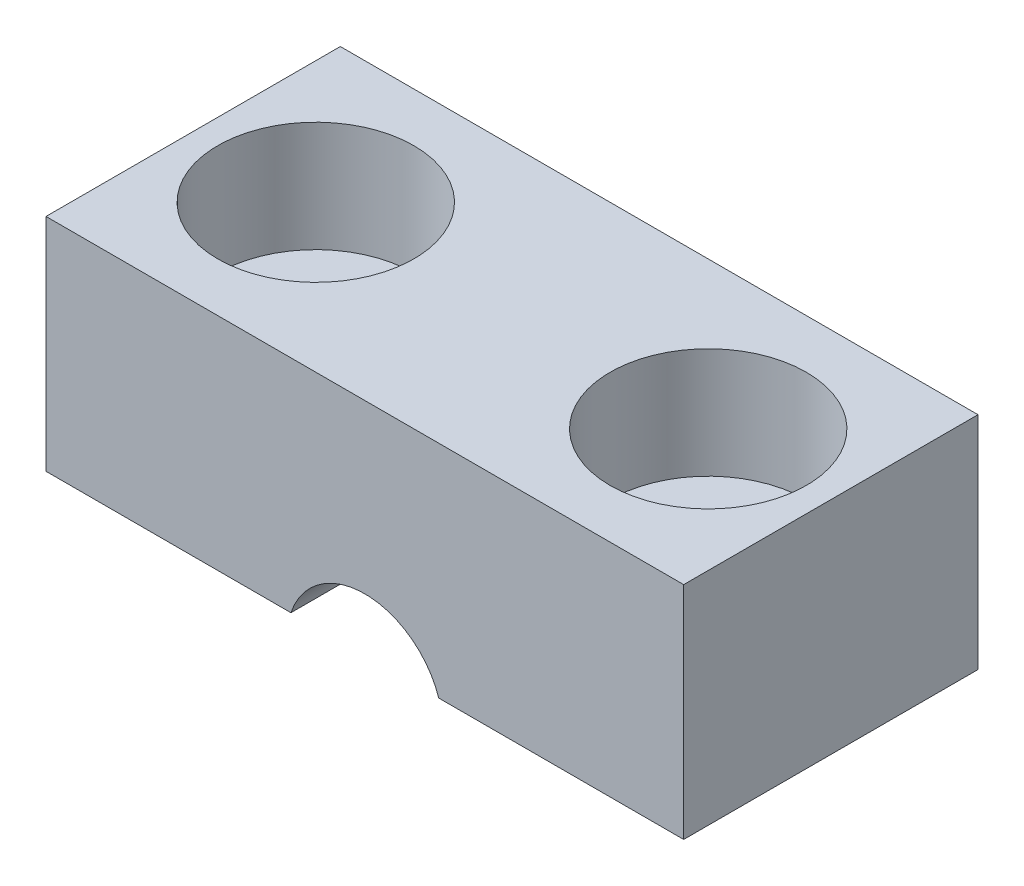
from build123d import *

# Parameters (mm, degrees)
SKETCH1_W                                        = 26
SKETCH1_H                                        = 12
BOSS_EXTRUDE1_DEPTH                              = 9
CUT_EXTRUDE1_DEPTH                               = 40.217343102
CBORE_FOR_M4_HEX_HEAD_MACHINE_SCREW1_D           = 4.5
CBORE_FOR_M4_HEX_HEAD_MACHINE_SCREW1_CBORE_D     = 8
CBORE_FOR_M4_HEX_HEAD_MACHINE_SCREW1_CBORE_DEPTH = 4.5


with BuildPart() as part:
    # Sketch1 → Boss-Extrude1 (new body)
    with BuildSketch(Plane(origin=(0, 35, 0), x_dir=(1, 0, 0), z_dir=(0, 1, 0))):
        Rectangle(SKETCH1_W, SKETCH1_H)
    extrude(amount=-BOSS_EXTRUDE1_DEPTH)

    # Sketch2 → Cut-Extrude1 (cut, through all)
    with BuildSketch(Plane(origin=(0, 0, -6), x_dir=(-1, 0, 0), z_dir=(0, 0, -1))):
        with BuildLine():
            Line((-3.01340754, 26), (3.01340754, 26))
            ThreePointArc((3.01340754, 26), (0, 28.175), (-3.01340754, 26))
        make_face()
    extrude(amount=-CUT_EXTRUDE1_DEPTH, mode=Mode.SUBTRACT)

    # CBORE for M4 Hex Head Machine Screw1 (through all)
    with Locations(Plane(origin=(0, 35, 0), x_dir=(1, 0, 0), z_dir=(0, 1, 0))):
        with Locations((-8, 0), (8, 0)):
            CounterBoreHole(CBORE_FOR_M4_HEX_HEAD_MACHINE_SCREW1_D / 2, CBORE_FOR_M4_HEX_HEAD_MACHINE_SCREW1_CBORE_D / 2, CBORE_FOR_M4_HEX_HEAD_MACHINE_SCREW1_CBORE_DEPTH)


solid = part.part
